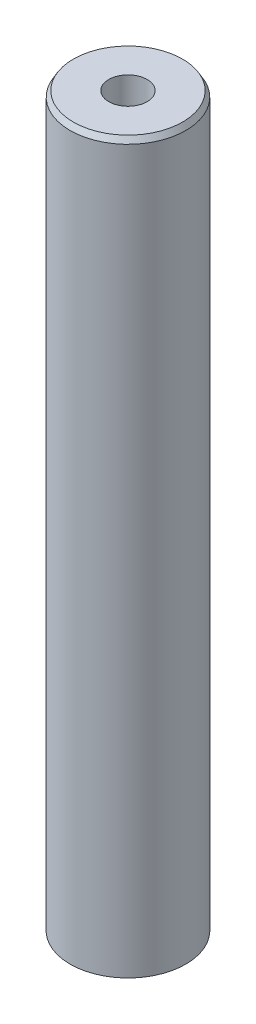
from build123d import *
from OCP.BRepFilletAPI import BRepFilletAPI_MakeChamfer

# Parameters (mm, degrees)
SKETCH1_R           = 47.5
BOSS_EXTRUDE1_DEPTH = 600
SKETCH2_R           = 15.794295083
CUT_EXTRUDE1_DEPTH  = 604.748706003
CHAMFER1_SIZE       = 4.633684046
CHAMFER1_SIZE2      = 2.675258731


with BuildPart() as part:
    # Sketch1 → Boss-Extrude1 (new body)
    with BuildSketch(Plane(origin=(0, 0, 0), x_dir=(1, 0, 0), z_dir=(0, 1, 0))):
        Circle(SKETCH1_R)
    extrude(amount=BOSS_EXTRUDE1_DEPTH)

    # Sketch2 → Cut-Extrude1 (cut, through all)
    with BuildSketch(Plane(origin=(0, 0, 0), x_dir=(1, 0, 0), z_dir=(0, 1, 0))):
        Circle(SKETCH2_R)
    extrude(amount=CUT_EXTRUDE1_DEPTH, mode=Mode.SUBTRACT)

    # Chamfer1: one chamfer whose edges measure the first distance from different faces: ONE call of the kernel's chamfer builder (chamfer() names one face for all edges)
    chamfer1_edges_1 = [part.edges().sort_by_distance(p)[0] for p in [
        (-47.5, 600, 0),
    ]]
    chamfer1_side_1 = [part.faces().sort_by_distance(p)[0] for p in [
        (-47.5, 300, 0),
    ]]
    chamfer1_edges_2 = [part.edges().sort_by_distance(p)[0] for p in [
        (-47.5, 0, 0),
    ]]
    chamfer1_side_2 = [part.faces().sort_by_distance(p)[0] for p in [
        (-46.156497116, 0, 0),
    ]]
    chamfer1 = BRepFilletAPI_MakeChamfer(part.part.solid().wrapped)
    for e in chamfer1_edges_1:
        chamfer1.Add(CHAMFER1_SIZE, CHAMFER1_SIZE2, e.wrapped, chamfer1_side_1[0].wrapped)  # the first distance lies on this face
    for e in chamfer1_edges_2:
        chamfer1.Add(CHAMFER1_SIZE, CHAMFER1_SIZE2, e.wrapped, chamfer1_side_2[0].wrapped)  # the first distance lies on this face
    add(Compound.cast(chamfer1.Shape()), mode=Mode.REPLACE)


solid = part.part
